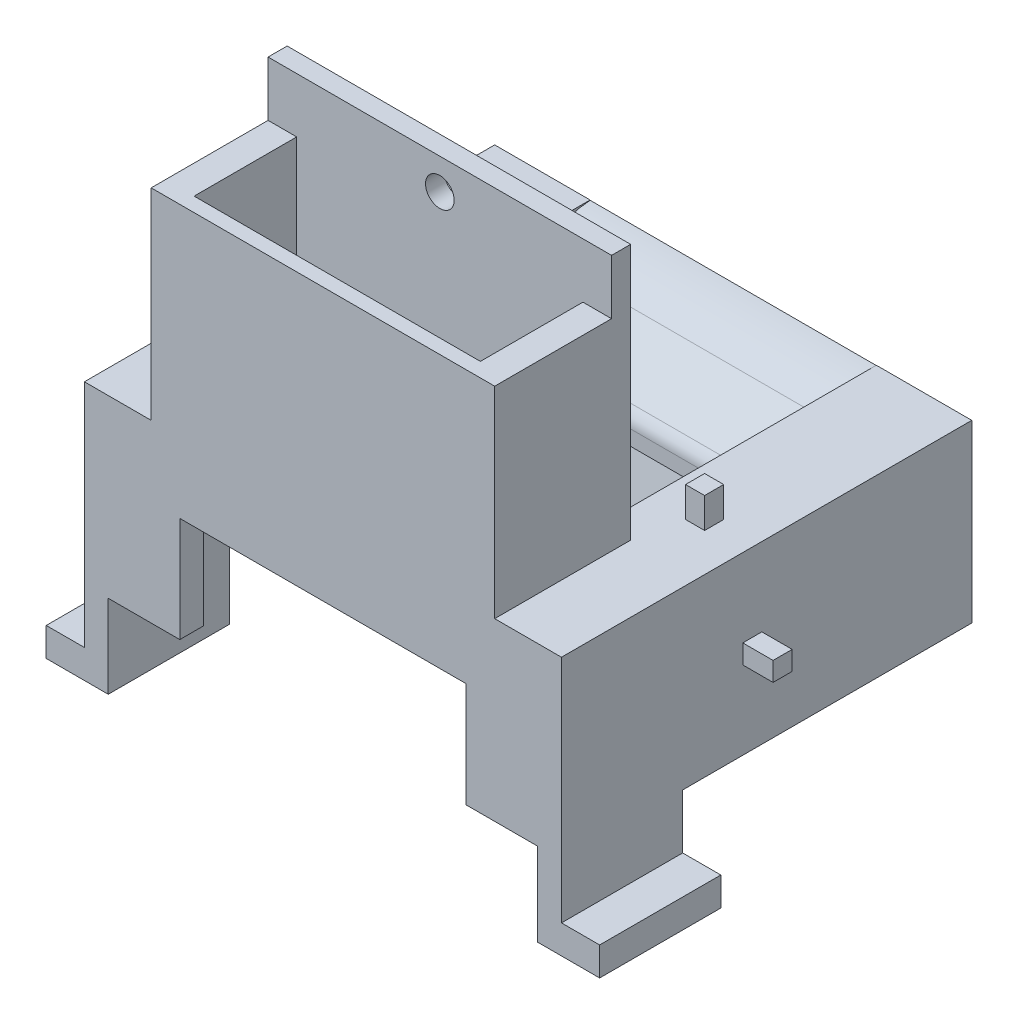
from build123d import *

# Parameters (mm, degrees)
SKETCH1_W               = 50
SKETCH1_H               = 18.4
BOSS_EXTRUDE1_DEPTH     = 43
SKETCH2_W               = 7.5
SKETCH2_H               = 5
SKETCH2_W_2             = 30
SKETCH2_H_2             = 1.8
CUT_EXTRUDE1_DEPTH      = 15.6
CUT_EXTRUDE2_START      = -22.5
CUT_EXTRUDE2_DEPTH      = 22.5
CUT_EXTRUDE3_START      = -15
CUT_EXTRUDE3_DEPTH      = 15
BOSS_EXTRUDE3_DEPTH     = 7.5
BOSS_EXTRUDE4_START     = 45
BOSS_EXTRUDE4_DEPTH     = 7.5
BOSS_EXTRUDE7_DEPTH     = 30
MTRL_RMV_DEPTH          = 60.694974663
SKETCH22_W              = 36
SKETCH22_H              = 24.066709319
SKETCH22_W_2            = 3
SKETCH22_H_2            = 2.783290681
BOSS_EXTRUDE8_DEPTH     = 2
BOSS_EXTRUDE9_DEPTH     = 36
SKETCH27_W              = 3
SKETCH27_H              = 21.1
BOSS_EXTRUDE10_DEPTH    = 14.25
SKETCH28_R              = 1.5
CUT_EXTRUDE4_DEPTH      = 53.451549072
SKETCH4_W               = 30
SKETCH4_H               = 11
WIRE_HOLE_DEPTH         = 2.5
SKETCH13_W              = 2
SKETCH13_H              = 2
FRONT_SHIELD_PEGS_DEPTH = 3.175
SKETCH14_W              = 2
SKETCH14_H              = 2
TOP_SHIELD_PEGS_DEPTH   = 3.175
FILLET9_R               = 10
FILLET10_R              = 2
LEGS_START              = 24
LEGS_DEPTH              = 12.7
SKETCH29_W              = 2
SKETCH29_H              = 2
SIDE_SHIELD_PEGS1_DEPTH = 3.175
SIDE_START              = -50
SKETCH29_2_W            = 2
SKETCH29_2_H            = 2
SIDE_SHIELD_PEGS2_DEPTH = 3.175


with BuildPart() as part:
    # Sketch1 → Boss-Extrude1 (new body)
    with BuildSketch(Plane.XY):
        Rectangle(SKETCH1_W, SKETCH1_H)
    extrude(amount=BOSS_EXTRUDE1_DEPTH)

    # Sketch2 → Cut-Extrude1 (cut)
    with BuildSketch(Plane(origin=(0, -9.2, 0), x_dir=(-1, 0, 0), z_dir=(0, -1, 0))):
        with Locations((-18.75, -12)):
            Rectangle(SKETCH2_W, SKETCH2_H)
        with Locations((18.75, -12)):
            Rectangle(SKETCH2_W, SKETCH2_H)
        with Locations((0, -12)):
            Rectangle(SKETCH2_W_2, SKETCH2_H_2)
    extrude(amount=-CUT_EXTRUDE1_DEPTH, mode=Mode.SUBTRACT)

    # Sketch3 → Cut-Extrude2 (cut)
    with BuildSketch(Plane(origin=(0, 0, 0), x_dir=(0, 0, -1), z_dir=(1, 0, 0)).offset(CUT_EXTRUDE2_START)):
        Polygon((-40.5, 6.2), (-40.5, -9.2), (-2.5, -9.2), (-2.5, 6.2), (-11.825335932, -1.144738516), align=None)
    cut_extrude2 = extrude(amount=CUT_EXTRUDE2_DEPTH, mode=Mode.SUBTRACT)

    # Mirror3: Cut-Extrude2 across plane
    add(cut_extrude2.mirror(Plane(origin=(0, 0, 0), x_dir=(0, 0, 1), z_dir=(1, 0, 0))), mode=Mode.SUBTRACT)

    # Sketch3<3> → Cut-Extrude3 (cut)
    with BuildSketch(Plane(origin=(0, 0, 0), x_dir=(0, 0, -1), z_dir=(1, 0, 0)).offset(CUT_EXTRUDE3_START)):
        Polygon((-12, 1.9), (-2.731466864, 9.2), (-40.5, 9.2), (-21.687267414, 4.381300074), (-12, 1.6), align=None)
    cut_extrude3 = extrude(amount=CUT_EXTRUDE3_DEPTH, mode=Mode.SUBTRACT)

    # Mirror4: Cut-Extrude3 across plane
    add(cut_extrude3.mirror(Plane(origin=(0, 0, 0), x_dir=(0, 0, 1), z_dir=(1, 0, 0))), mode=Mode.SUBTRACT)

    # Sketch12 → Boss-Extrude3 (add)
    with BuildSketch(Plane.ZY.offset(-22.5)):
        Polygon((9.5, 6.4), (9.5, 0.686721981), (9.625, 6.4), align=None)
        Polygon((14.5, 6.4), (14.5, 0.686721981), (14.375, 6.4), align=None)
    extrude(amount=BOSS_EXTRUDE3_DEPTH)

    # Sketch12<2> → Boss-Extrude4 (add)
    with BuildSketch(Plane.ZY.offset(-22.5).offset(BOSS_EXTRUDE4_START)):
        Polygon((9.5, 6.4), (9.5, 0.686721981), (9.625, 6.4), align=None)
        Polygon((14.5, 6.4), (14.5, 0.686721981), (14.375, 6.4), align=None)
    extrude(amount=-BOSS_EXTRUDE4_DEPTH)

    # Sketch17 → Boss-Extrude7 (add)
    with BuildSketch(Plane(origin=(-15, 0, 0), x_dir=(0, 0, -1), z_dir=(1, 0, 0))):
        Polygon((-43, 9.2), (-43, 10.7), (-21.687267414, 4.381300074), (-40.5, 9.2), align=None)
    extrude(amount=BOSS_EXTRUDE7_DEPTH)

    # Sketch18 → Mtrl Rmv (cut, through all)
    with BuildSketch(Plane(origin=(15, 0, 0), x_dir=(0, 0, -1), z_dir=(1, 0, 0))):
        Polygon((-43, 10.7), (-43, 9.2), (-37.940557511, 9.2), align=None)
    extrude(amount=-MTRL_RMV_DEPTH, mode=Mode.SUBTRACT)

    # Sketch22 → Boss-Extrude8 (add)
    with BuildSketch(Plane.XY.offset(30.75)):
        with Locations((0, 24.016645341)):
            Rectangle(SKETCH22_W, SKETCH22_H)
        with Locations((16.5, 10.591645341)):
            Rectangle(SKETCH22_W_2, SKETCH22_H_2)
        with Locations((-16.5, 10.591645341)):
            Rectangle(SKETCH22_W_2, SKETCH22_H_2)
    extrude(amount=-BOSS_EXTRUDE8_DEPTH)

    # Sketch25 → Boss-Extrude9 (add)
    with BuildSketch(Plane(origin=(18, 0, 0), x_dir=(0, 0, -1), z_dir=(1, 0, 0))):
        Polygon((-43, 30.3), (-43, 9.2), (-37.940557511, 9.2), (-41.5, 10.25528697), (-41.5, 18.655212051), (-35.764164569, 18.655212051), (-41.5, 23.3), (-41.5, 30.3), align=None)
        Polygon((-30.75, 11.983290681), (-30.75, 18.655212051), (-34.323998772, 11.983290681), align=None)
    extrude(amount=-BOSS_EXTRUDE9_DEPTH)

    # Sketch27 → Boss-Extrude10 (add)
    with BuildSketch(Plane.XY.offset(43)):
        with Locations((-16.5, 19.75)):
            Rectangle(SKETCH27_W, SKETCH27_H)
        with Locations((16.5, 19.75)):
            Rectangle(SKETCH27_W, SKETCH27_H)
    extrude(amount=-BOSS_EXTRUDE10_DEPTH)

    # Sketch28 → Cut-Extrude4 (cut, through all)
    with BuildSketch(Plane(origin=(0, 0, 28.75), x_dir=(-1, 0, 0), z_dir=(0, 0, -1))):
        with Locations((0, 32.8)):
            Circle(SKETCH28_R)
    extrude(amount=-CUT_EXTRUDE4_DEPTH, mode=Mode.SUBTRACT)

    # Sketch4 → Wire Hole (cut)
    with BuildSketch(Plane.XY.offset(43)):
        with Locations((0, -3.7)):
            Rectangle(SKETCH4_W, SKETCH4_H)
    extrude(amount=-WIRE_HOLE_DEPTH, mode=Mode.SUBTRACT)

    # Sketch13 → Front Shield Pegs (add)
    with BuildSketch(Plane(origin=(0, 0, 0), x_dir=(-1, 0, 0), z_dir=(0, 0, -1))):
        with Locations((-14, 0)):
            Rectangle(SKETCH13_W, SKETCH13_H)
        with Locations((14, 0)):
            Rectangle(SKETCH13_W, SKETCH13_H)
    extrude(amount=FRONT_SHIELD_PEGS_DEPTH)

    # Sketch14 → Top Shield Pegs (add)
    with BuildSketch(Plane(origin=(0, 9.2, 0), x_dir=(1, 0, 0), z_dir=(0, 1, 0))):
        with Locations((20, -23)):
            Rectangle(SKETCH14_W, SKETCH14_H)
        with Locations((-20, -23)):
            Rectangle(SKETCH14_W, SKETCH14_H)
    extrude(amount=TOP_SHIELD_PEGS_DEPTH)

    # Fillet9
    # the kernel refuses this fillet: 10 mm, written as the material it takes off along each edge
    with BuildSketch(Plane(origin=(-15, 9.2, 2.731466864), x_dir=(0, 0, -1), z_dir=(1, 0, 0))) as fillet9_piece_1:
        with BuildLine():
            CenterArc((FILLET9_R * 0.346519160452, -FILLET9_R), FILLET9_R, 90, 38.224362431)
            Line((-FILLET9_R * 0.27222332899, -FILLET9_R * 0.214406127977), (0, 0))
            Line((0, 0), (FILLET9_R * 0.346519160452, 0))
        make_face()
    extrude(amount=30, mode=Mode.SUBTRACT)

    # Fillet10
    fillet10_edges = [part.edges().sort_by_distance(p)[0] for p in [
        (0, 2.608850031, 11.1),
    ]]
    fillet(fillet10_edges, radius=FILLET10_R)

    # Sketch19 → Legs (add)
    with BuildSketch(Plane.XY.offset(19).offset(LEGS_START)):
        Polygon((22.5, -9.2), (22.5, -17.915), (29, -17.915), (29, -14.915), (25, -14.915), (25, -9.2), align=None)
        Polygon((-22.5, -9.2), (-22.5, -17.915), (-29, -17.915), (-29, -14.915), (-25, -14.915), (-25, -9.2), align=None)
    extrude(amount=-LEGS_DEPTH)

    # Sketch29 → Side Shield Pegs1 (add)
    with BuildSketch(Plane.ZY.offset(25)):
        with Locations((23, 0)):
            Rectangle(SKETCH29_W, SKETCH29_H)
    extrude(amount=SIDE_SHIELD_PEGS1_DEPTH)

    # Sketch29<2> → Side Shield Pegs2 (add)
    with BuildSketch(Plane.ZY.offset(25).offset(SIDE_START)):
        with Locations((23, 0)):
            Rectangle(SKETCH29_2_W, SKETCH29_2_H)
    extrude(amount=-SIDE_SHIELD_PEGS2_DEPTH)


solid = part.part
